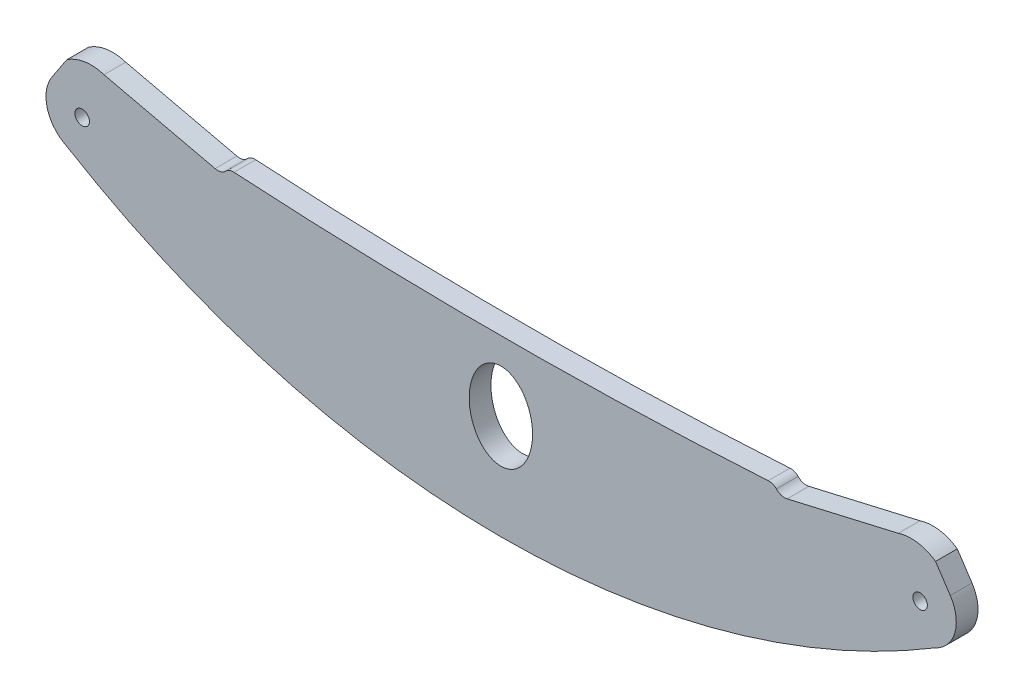
from build123d import *

# Parameters (mm, degrees)
SKETCH1_R           = 1
SKETCH1_RX          = 5.989924498
SKETCH1_RY          = 4.37292764
BOSS_EXTRUDE1_DEPTH = 3


with BuildPart() as part:
    # Sketch1 → Boss-Extrude1 (new body)
    with BuildSketch(Plane.XY):
        with BuildLine():
            Line((954.702521289, 110.90381029), (952.670928809, 113.968666581))
            ThreePointArc((952.670928809, 113.968666581), (950.18826957, 114.970742443), (947.519688189, 114.755274729))
            Line((947.519688189, 114.755274729), (932.172066536, 111.200676976))
            ThreePointArc((932.172066536, 111.200676976), (931.366268376, 111.218620275), (930.686084525, 111.65103508))
            ThreePointArc((930.686084525, 111.65103508), (930.167968592, 111.983103753), (929.557642996, 112.061947844))
            ThreePointArc((929.557642996, 112.061947844), (892.663576086, 110.941819466), (855.769509176, 112.061947844))
            ThreePointArc((855.769509176, 112.061947844), (855.167872493, 111.978815429), (854.65750502, 111.649569718))
            ThreePointArc((854.65750502, 111.649569718), (853.977337837, 111.217128694), (853.171540371, 111.199154333))
            Line((853.171540371, 111.199154333), (837.823781708, 114.753160468))
            ThreePointArc((837.823781708, 114.753160468), (835.155192022, 114.968525315), (832.672571413, 113.966353753))
            Line((832.672571413, 113.966353753), (830.641097077, 110.901419151))
            ThreePointArc((830.641097077, 110.901419151), (830.000519222, 106.767582069), (832.725500034, 103.593715565))
            ThreePointArc((832.725500034, 103.593715565), (892.672272118, 86.883777865), (952.618400028, 103.596026361))
            ThreePointArc((952.618400028, 103.596026361), (955.343258494, 106.769997904), (954.702521289, 110.90381029))
        make_face()
        with Locations((834.808748942, 108.139050976)):
            Circle(SKETCH1_R, mode=Mode.SUBTRACT)
        with Locations((950.534975911, 108.141281463)):
            Circle(SKETCH1_R, mode=Mode.SUBTRACT)
        with Locations(Location((892.63595645, 101.327823749), (0, 0, -90))):
            Ellipse(SKETCH1_RX, SKETCH1_RY, mode=Mode.SUBTRACT)
    extrude(amount=BOSS_EXTRUDE1_DEPTH)


solid = part.part
